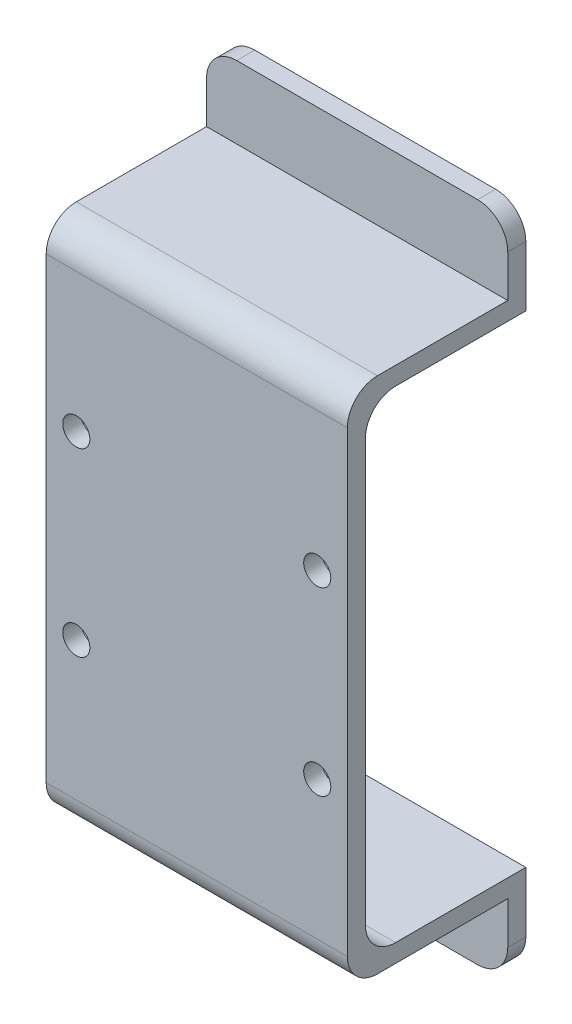
from build123d import *

# Parameters (mm, degrees)
SALIENTE_EXTRUIR1_DEPTH   = 6
SALIENTE_EXTRUIR1_2_DEPTH = 6
CROQUIS3_W                = 100
CROQUIS3_H                = 6
SALIENTE_EXTRUIR2_DEPTH   = 47.25
CROQUIS4_W                = 100
CROQUIS4_H                = 172
SALIENTE_EXTRUIR3_DEPTH   = 6
REDONDEO1_R               = 10
CROQUIS5_R                = 4.5
CORTAR_EXTRUIR1_DEPTH     = 401.296792763


with BuildPart() as part:
    # Croquis1 → Saliente-Extruir1 (new body)
    with BuildSketch(Plane.XY):
        with BuildLine():
            Line((26.893497848, -345), (126.893497848, -345))
            Line((126.893497848, -345), (126.893497848, -365))
            ThreePointArc((126.893497848, -365), (123.96456566, -372.071067812), (116.893497848, -375))
            Line((116.893497848, -375), (36.893497848, -375))
            ThreePointArc((36.893497848, -375), (29.822430037, -372.071067812), (26.893497848, -365))
            Line((26.893497848, -365), (26.893497848, -345))
        make_face()
    extrude(amount=SALIENTE_EXTRUIR1_DEPTH)



with BuildPart() as body_2:
    # Croquis1 → Saliente-Extruir1 2 (new body)
    with BuildSketch(Plane.XY):
        with BuildLine():
            Line((36.893497848, -155), (116.893497848, -155))
            ThreePointArc((116.893497848, -155), (123.96456566, -157.928932188), (126.893497848, -165))
            Line((126.893497848, -165), (126.893497848, -185))
            Line((126.893497848, -185), (26.893497848, -185))
            Line((26.893497848, -185), (26.893497848, -165))
            ThreePointArc((26.893497848, -165), (29.822430037, -157.928932188), (36.893497848, -155))
        make_face()
    extrude(amount=SALIENTE_EXTRUIR1_2_DEPTH)


with BuildPart() as part_1:
    add(part.part)

    add(body_2.part)  # Saliente-Extruir2 merges body 2
    # Croquis3 → Saliente-Extruir2 (add)
    with BuildSketch(Plane.XY.offset(6)):
        with Locations((76.893497848, -348)):
            Rectangle(CROQUIS3_W, CROQUIS3_H)
        with Locations((76.893497848, -182)):
            Rectangle(CROQUIS3_W, CROQUIS3_H)
    extrude(amount=SALIENTE_EXTRUIR2_DEPTH)

    # Croquis4 → Saliente-Extruir3 (add)
    with BuildSketch(Plane.XY.offset(53.25)):
        with Locations((76.893497848, -265)):
            Rectangle(CROQUIS4_W, CROQUIS4_H)
    extrude(amount=SALIENTE_EXTRUIR3_DEPTH)

    # Redondeo1
    redondeo1_edges = [part_1.edges().sort_by_distance(p)[0] for p in [
        (76.893497848, -351, 59.25),
        (76.893497848, -345, 53.25),
        (76.893497848, -179, 59.25),
        (76.893497848, -185, 53.25),
    ]]
    fillet(redondeo1_edges, radius=REDONDEO1_R)

    # Croquis5 → Cortar-Extruir1 (cut, through all)
    with BuildSketch(Plane.XY.offset(59.25)):
        with Locations((36.893497848, -235)):
            Circle(CROQUIS5_R)
        with Locations((116.893497848, -235)):
            Circle(CROQUIS5_R)
        with Locations((36.893497848, -295)):
            Circle(CROQUIS5_R)
        with Locations((116.893497848, -295)):
            Circle(CROQUIS5_R)
    extrude(amount=-CORTAR_EXTRUIR1_DEPTH, mode=Mode.SUBTRACT)


solid = part_1.part
